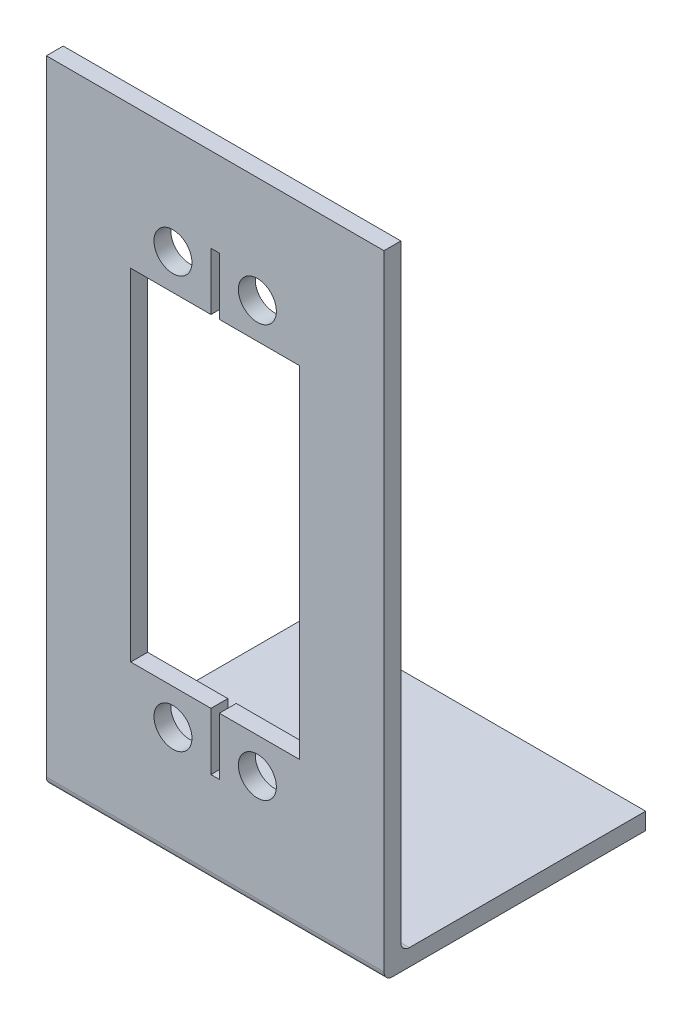
from build123d import *

# Parameters (mm, degrees)
SKETCH1_W                   = 40
SKETCH1_H                   = 30
BOSS_EXTRUDE1_DEPTH         = 2
BOSS_EXTRUDE2_DEPTH         = 73
BOSS_EXTRUDE2_DEPTH_BACK    = 2
SKETCH2_W                   = 40
SKETCH2_H                   = 2
FILLET1_R                   = 1
SKETCH4_R                   = 2.25
CUT_EXTRUDE1_DEPTH          = 49
M3_TAPPED_HOLE1_D           = 2.5
M3_TAPPED_HOLE1_CSINK_D     = 3.05
M3_TAPPED_HOLE1_CSINK_ANGLE = 90


with BuildPart() as part:
    # Sketch1 → Boss-Extrude1 (new body)
    with BuildSketch(Plane(origin=(0, 0, 0), x_dir=(1, 0, 0), z_dir=(0, 1, 0))):
        with Locations((20, 15)):
            Rectangle(SKETCH1_W, SKETCH1_H)
    extrude(amount=BOSS_EXTRUDE1_DEPTH)

    # Sketch2 → Boss-Extrude2 (add, two sides: drawn at the far end of the back side and taken through both)
    with BuildSketch(Plane(origin=(0, 2, 0), x_dir=(1, 0, 0), z_dir=(0, 1, 0)).offset(-BOSS_EXTRUDE2_DEPTH_BACK)):
        with Locations((20, 0)):
            Rectangle(SKETCH2_W, SKETCH2_H)
    extrude(amount=BOSS_EXTRUDE2_DEPTH + BOSS_EXTRUDE2_DEPTH_BACK)

    # Fillet1
    fillet1_edges = [part.edges().sort_by_distance(p)[0] for p in [
        (20, 0, 1),
        (20, 2, -1),
    ]]
    fillet(fillet1_edges, radius=FILLET1_R)

    # Sketch4 → Cut-Extrude1 (cut)
    with BuildSketch(Plane.XY.offset(1)):
        Polygon((20.5, 65), (19.5, 65), (19.5, 58.2), (10, 58.2), (10, 17.8), (19.5, 17.8), (19.5, 11), (20.5, 11), (20.5, 17.8), (30, 17.8), (30, 58.2), (20.5, 58.2), align=None)
        with Locations((15, 62.4)):
            Circle(SKETCH4_R)
        with Locations((25, 62.4)):
            Circle(SKETCH4_R)
        with Locations((25, 13.6)):
            Circle(SKETCH4_R)
        with Locations((15, 13.6)):
            Circle(SKETCH4_R)
    extrude(amount=-CUT_EXTRUDE1_DEPTH, mode=Mode.SUBTRACT)

    # M3 Tapped Hole1 (through all)
    with Locations(Plane(origin=(0, 2, 0), x_dir=(1, 0, 0), z_dir=(0, 1, 0))):
        with Locations((20, 15)):
            CounterSinkHole(M3_TAPPED_HOLE1_D / 2, M3_TAPPED_HOLE1_CSINK_D / 2, counter_sink_angle=M3_TAPPED_HOLE1_CSINK_ANGLE)


solid = part.part
